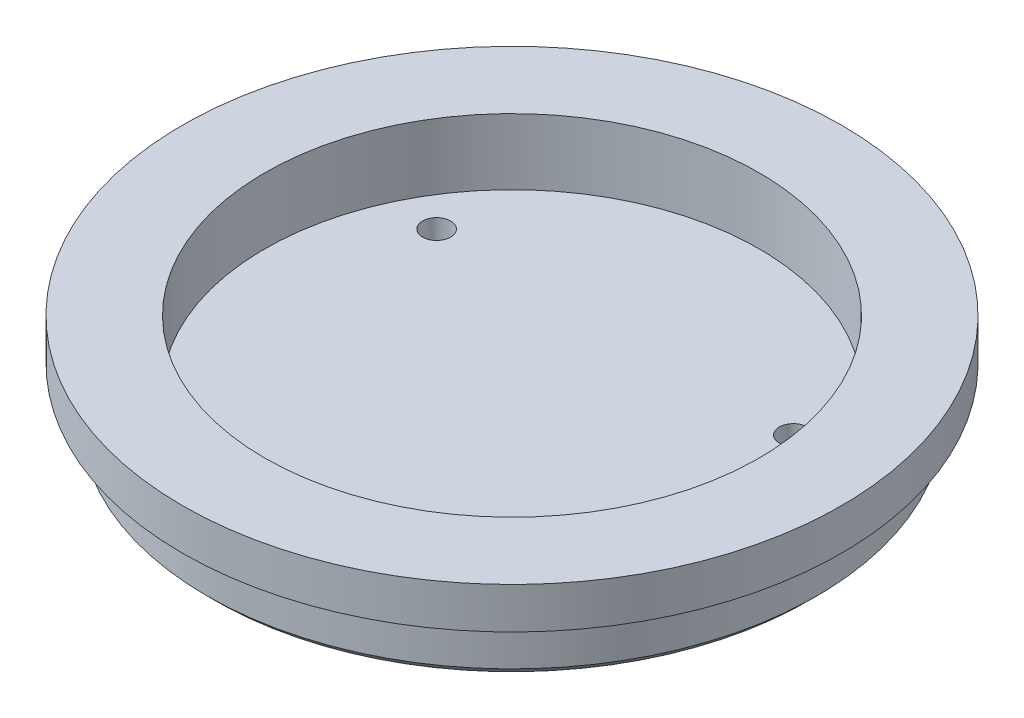
from build123d import *

# Parameters (mm, degrees)
CHAMFER_1_SIZE      = 1
HOLE_WIZARD_M3_1_D  = 3.4
SKETCH_4_R          = 30
CUT_EXTRUDE_1_DEPTH = 8


with BuildPart() as part:
    # 草图1 → 旋转1 (revolve)
    with BuildSketch(Plane(origin=(0, 0, 0), x_dir=(0, 0, -1), z_dir=(1, 0, 0))):
        Polygon((0, 0), (37, 0), (37, 7), (40, 7), (40, 12), (0, 12), align=None)
    revolve(axis=Axis((0, 0, 0), (0, 1, 0)))

    # 倒角1
    chamfer_1_edges = [part.edges().sort_by_distance(p)[0] for p in [
        (0, 0, 37),
    ]]
    chamfer(chamfer_1_edges, length=CHAMFER_1_SIZE)

    # M3 间隙孔1 (through all)
    with Locations(Plane(origin=(0, 12, 0), x_dir=(-1, 0, 0), z_dir=(0, 1, 0))):
        with Locations((0, 25), (-21.650635095, -12.5), (21.650635095, -12.5)):
            Hole(HOLE_WIZARD_M3_1_D / 2)

    # 草图4 → 切除-拉伸1 (cut)
    with BuildSketch(Plane(origin=(0, 12, 0), x_dir=(1, 0, 0), z_dir=(0, 1, 0))):
        Circle(SKETCH_4_R)
    extrude(amount=-CUT_EXTRUDE_1_DEPTH, mode=Mode.SUBTRACT)


solid = part.part
